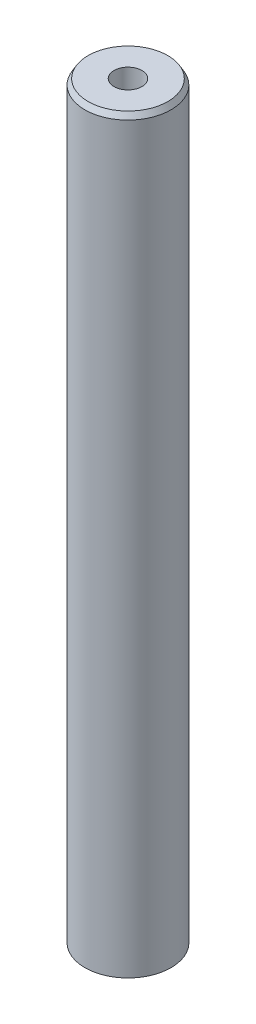
from build123d import *
from OCP.BRepFilletAPI import BRepFilletAPI_MakeChamfer

# Parameters (mm, degrees)
SKETCH1_R           = 5
BOSS_EXTRUDE1_DEPTH = 87.270153296
SKETCH2_R           = 1.622933859
CUT_EXTRUDE1_DEPTH  = 88.556151448
CHAMFER1_SIZE       = 0.645972691
CHAMFER1_SIZE2      = 0.372952507


with BuildPart() as part:
    # Sketch1 → Boss-Extrude1 (new body)
    with BuildSketch(Plane(origin=(0, 0, 0), x_dir=(1, 0, 0), z_dir=(0, 1, 0))):
        Circle(SKETCH1_R)
    extrude(amount=BOSS_EXTRUDE1_DEPTH)

    # Sketch2 → Cut-Extrude1 (cut, through all)
    with BuildSketch(Plane(origin=(0, 0, 0), x_dir=(1, 0, 0), z_dir=(0, 1, 0))):
        Circle(SKETCH2_R)
    extrude(amount=CUT_EXTRUDE1_DEPTH, mode=Mode.SUBTRACT)

    # Chamfer1: one chamfer whose edges measure the first distance from different faces: ONE call of the kernel's chamfer builder (chamfer() names one face for all edges)
    chamfer1_edges_1 = [part.edges().sort_by_distance(p)[0] for p in [
        (-5, 87.270153296, 0),
    ]]
    chamfer1_side_1 = [part.faces().sort_by_distance(p)[0] for p in [
        (-5, 43.635076648, 0),
    ]]
    chamfer1_edges_2 = [part.edges().sort_by_distance(p)[0] for p in [
        (-5, 0, 0),
    ]]
    chamfer1_side_2 = [part.faces().sort_by_distance(p)[0] for p in [
        (-4.858578644, 0, 0),
    ]]
    chamfer1 = BRepFilletAPI_MakeChamfer(part.part.solid().wrapped)
    for e in chamfer1_edges_1:
        chamfer1.Add(CHAMFER1_SIZE, CHAMFER1_SIZE2, e.wrapped, chamfer1_side_1[0].wrapped)  # the first distance lies on this face
    for e in chamfer1_edges_2:
        chamfer1.Add(CHAMFER1_SIZE, CHAMFER1_SIZE2, e.wrapped, chamfer1_side_2[0].wrapped)  # the first distance lies on this face
    add(Compound.cast(chamfer1.Shape()), mode=Mode.REPLACE)


solid = part.part
